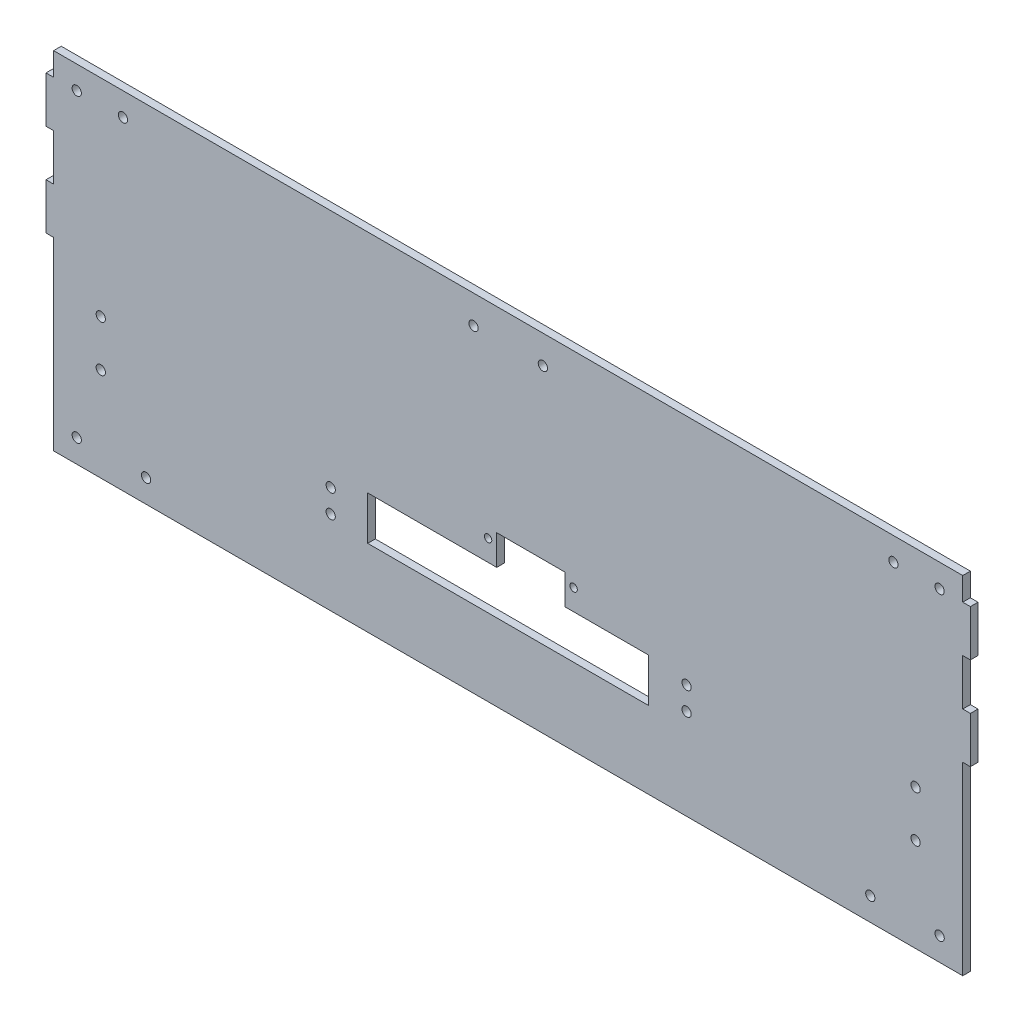
from build123d import *

# Parameters (mm, degrees)
SKETCH1_W           = 393.4
SKETCH1_H           = 150
BOSS_EXTRUDE1_DEPTH = 3.3
SKETCH2_R           = 2
CUT_EXTRUDE1_DEPTH  = 257.520622953
SKETCH3_R           = 2
CUT_EXTRUDE2_DEPTH  = 4
SKETCH4_R           = 2
CUT_EXTRUDE3_DEPTH  = 4
CUT_EXTRUDE4_DEPTH  = 10
SKETCH7_R           = 2
SKETCH7_R_2         = 1.6
CUT_EXTRUDE5_DEPTH  = 10
SKETCH8_W           = 3.3
SKETCH8_H           = 20
SKETCH8_H_2         = 19.969591437
BOSS_EXTRUDE2_DEPTH = 3.3


with BuildPart() as part:
    # Sketch1 → Boss-Extrude1 (new body)
    with BuildSketch(Plane.XY):
        with Locations((27, -50.5)):
            Rectangle(SKETCH1_W, SKETCH1_H)
    extrude(amount=BOSS_EXTRUDE1_DEPTH)

    # Sketch2 → Cut-Extrude1 (cut, through all)
    with BuildSketch(Plane(origin=(0, 0, 0), x_dir=(-1, 0, 0), z_dir=(0, 0, -1))):
        with Locations((-183.7, -115.5)):
            Circle(SKETCH2_R)
        with Locations((-213.7, -115.5)):
            Circle(SKETCH2_R)
        with Locations((129.7, -115.5)):
            Circle(SKETCH2_R)
        with Locations((159.7, -115.5)):
            Circle(SKETCH2_R)
    extrude(amount=-CUT_EXTRUDE1_DEPTH, mode=Mode.SUBTRACT)

    # Sketch3 → Cut-Extrude2 (cut)
    with BuildSketch(Plane.XY.offset(3.3)):
        with Locations((-159.7, 14.5)):
            Circle(SKETCH3_R)
        with Locations((-139.7, 14.5)):
            Circle(SKETCH3_R)
        with Locations((193.7, 14.5)):
            Circle(SKETCH3_R)
        with Locations((213.7, 14.5)):
            Circle(SKETCH3_R)
    extrude(amount=-CUT_EXTRUDE2_DEPTH, mode=Mode.SUBTRACT)

    # Sketch4 → Cut-Extrude3 (cut)
    with BuildSketch(Plane.XY.offset(3.3)):
        with Locations((12, 12.25)):
            Circle(SKETCH4_R)
        with Locations((42, 12.25)):
            Circle(SKETCH4_R)
    extrude(amount=-CUT_EXTRUDE3_DEPTH, mode=Mode.SUBTRACT)

    # Sketch6 → Cut-Extrude4 (cut)
    with BuildSketch(Plane(origin=(0, 0, 0), x_dir=(-1, 0, 0), z_dir=(0, 0, -1))):
        Polygon((-22.05, -60.29238211), (-51.55, -60.29238211), (-51.55, -73.29238211), (-87.789723738, -73.29238211), (-87.789723738, -92.19238211), (33.789723738, -92.19238211), (33.789723738, -73.29238211), (-22.05, -73.29238211), align=None)
    extrude(amount=-CUT_EXTRUDE4_DEPTH, mode=Mode.SUBTRACT)

    # Sketch7 → Cut-Extrude5 (cut)
    with BuildSketch(Plane.XY.offset(3.3)):
        with Locations((-149.298074337, -64.95)):
            Circle(SKETCH7_R)
        with Locations((-149.298074337, -84.95)):
            Circle(SKETCH7_R)
        with Locations((-49.797853771, -89.24238211)):
            Circle(SKETCH7_R)
        with Locations((-49.797853771, -79.24238211)):
            Circle(SKETCH7_R)
        with Locations((18.3, -64.226876466)):
            Circle(SKETCH7_R_2)
        with Locations((55.3, -64.226876466)):
            Circle(SKETCH7_R_2)
        with Locations((104.201387796, -76.24238211)):
            Circle(SKETCH7_R)
        with Locations((104.201387796, -86.24238211)):
            Circle(SKETCH7_R)
        with Locations((203.298074337, -84.968209124)):
            Circle(SKETCH7_R)
        with Locations((203.298074337, -64.968209124)):
            Circle(SKETCH7_R)
    extrude(amount=-CUT_EXTRUDE5_DEPTH, mode=Mode.SUBTRACT)

    # Sketch8 → Boss-Extrude2 (add)
    with BuildSketch(Plane.XY.offset(3.3)):
        with Locations((-171.35, 4.5)):
            Rectangle(SKETCH8_W, SKETCH8_H)
        with Locations((-171.35, -35.515204282)):
            Rectangle(SKETCH8_W, SKETCH8_H_2)
        with Locations((225.35, -35.515204282)):
            Rectangle(SKETCH8_W, SKETCH8_H_2)
        with Locations((225.35, 4.5)):
            Rectangle(SKETCH8_W, SKETCH8_H)
    extrude(amount=-BOSS_EXTRUDE2_DEPTH)


solid = part.part
